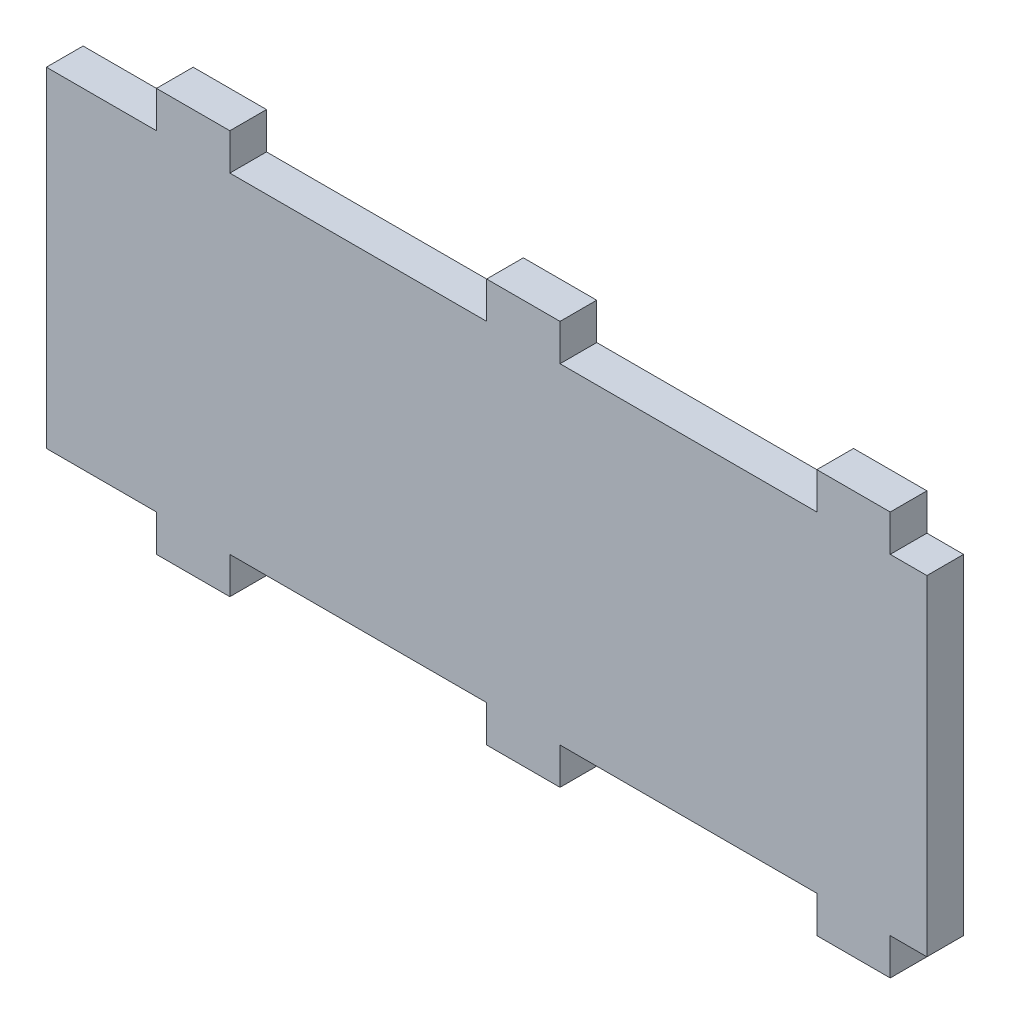
from build123d import *

# Parameters (mm, degrees)
BOSS_EXTRU_1_DEPTH = 5


with BuildPart() as part:
    # Esquisse1 → Boss.-Extru.1 (new body)
    with BuildSketch(Plane.XY):
        Polygon((0, 0), (15, 0), (15, -5), (25, -5), (25, 0), (60, 0), (60, -5), (70, -5), (70, 0), (105, 0), (105, -5), (115, -5), (115, 0), (120, 0), (120, 45), (115, 45), (115, 50), (105, 50), (105, 45), (70, 45), (70, 50), (60, 50), (60, 45), (25, 45), (25, 50), (15, 50), (15, 45), (0, 45), align=None)
    extrude(amount=BOSS_EXTRU_1_DEPTH)


solid = part.part
